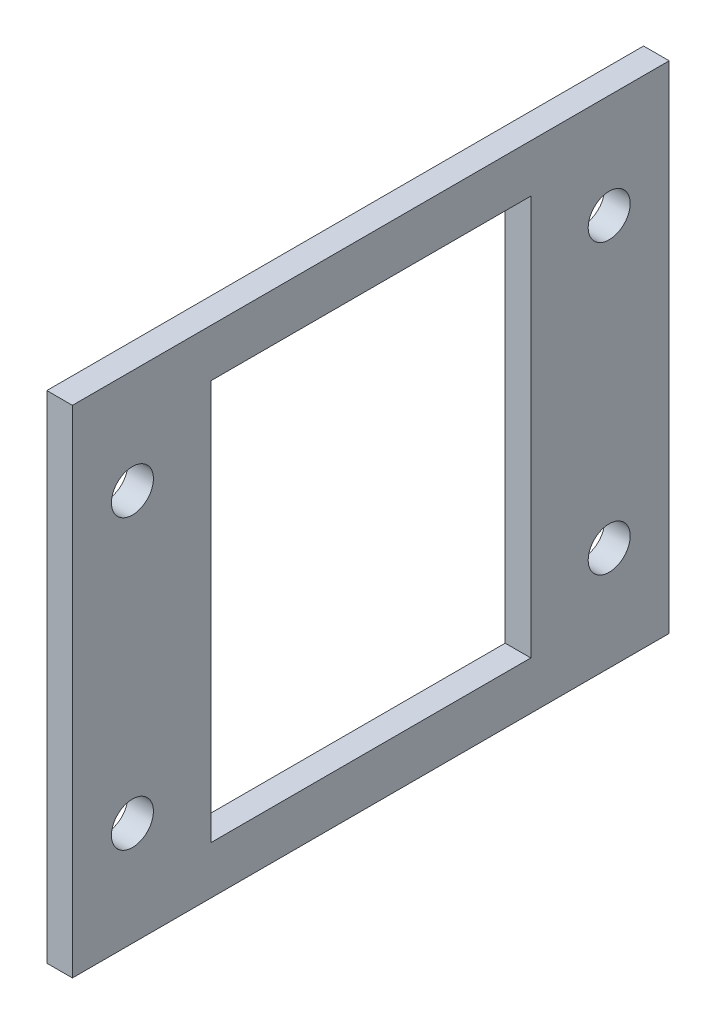
from build123d import *

# Parameters (mm, degrees)
SKETCH1_W           = 74.6
SKETCH1_H           = 62
BOSS_EXTRUDE1_DEPTH = 3.2
CUT_EXTRUDE1_REACH  = 99.054
SKETCH2_W           = 40
SKETCH2_H           = 50
CUT_EXTRUDE2_REACH  = 99.054
SKETCH3_R           = 2.625


with BuildPart() as part:
    # Sketch1 → Boss-Extrude1 (new body)
    with BuildSketch(Plane(origin=(0, 0, 0), x_dir=(0, 0, -1), z_dir=(1, 0, 0))):
        with Locations((37.3, 31)):
            Rectangle(SKETCH1_W, SKETCH1_H)
    extrude(amount=BOSS_EXTRUDE1_DEPTH)

    # Sketch2 → Cut-Extrude1 (cut, up to next)
    with BuildSketch(Plane(origin=(3.2, 0, 0), x_dir=(0, 0, -1), z_dir=(1, 0, 0)), mode=Mode.PRIVATE) as cut_extrude1_sk1:
        with Locations((37.3, 31)):
            Rectangle(SKETCH2_W, SKETCH2_H)
    cut_extrude1_tool1 = extrude(cut_extrude1_sk1.sketch, amount=-CUT_EXTRUDE1_REACH, mode=Mode.PRIVATE) & part.part
    add(cut_extrude1_tool1.solids().sort_by_distance((3.2, 31, -37.3))[0], mode=Mode.SUBTRACT)

    # Sketch3 → Cut-Extrude2 (cut, up to next)
    with BuildSketch(Plane.ZY, mode=Mode.PRIVATE) as cut_extrude2_sk1:
        with Locations((-67.1, 13)):
            Circle(SKETCH3_R)
    cut_extrude2_tool1 = extrude(cut_extrude2_sk1.sketch, amount=-CUT_EXTRUDE2_REACH, mode=Mode.PRIVATE) & part.part
    # Sketch3 → Cut-Extrude2 (cut, up to next)
    with BuildSketch(Plane.ZY, mode=Mode.PRIVATE) as cut_extrude2_sk2:
        with Locations((-67.1, 49)):
            Circle(SKETCH3_R)
    cut_extrude2_tool2 = extrude(cut_extrude2_sk2.sketch, amount=-CUT_EXTRUDE2_REACH, mode=Mode.PRIVATE) & part.part
    # Sketch3 → Cut-Extrude2 (cut, up to next)
    with BuildSketch(Plane.ZY, mode=Mode.PRIVATE) as cut_extrude2_sk3:
        with Locations((-7.5, 49)):
            Circle(SKETCH3_R)
    cut_extrude2_tool3 = extrude(cut_extrude2_sk3.sketch, amount=-CUT_EXTRUDE2_REACH, mode=Mode.PRIVATE) & part.part
    # Sketch3 → Cut-Extrude2 (cut, up to next)
    with BuildSketch(Plane.ZY, mode=Mode.PRIVATE) as cut_extrude2_sk4:
        with Locations((-7.5, 13)):
            Circle(SKETCH3_R)
    cut_extrude2_tool4 = extrude(cut_extrude2_sk4.sketch, amount=-CUT_EXTRUDE2_REACH, mode=Mode.PRIVATE) & part.part
    add(cut_extrude2_tool1.solids().sort_by_distance((0, 13, -67.1))[0], mode=Mode.SUBTRACT)
    add(cut_extrude2_tool2.solids().sort_by_distance((0, 49, -67.1))[0], mode=Mode.SUBTRACT)
    add(cut_extrude2_tool3.solids().sort_by_distance((0, 49, -7.5))[0], mode=Mode.SUBTRACT)
    add(cut_extrude2_tool4.solids().sort_by_distance((0, 13, -7.5))[0], mode=Mode.SUBTRACT)


solid = part.part
